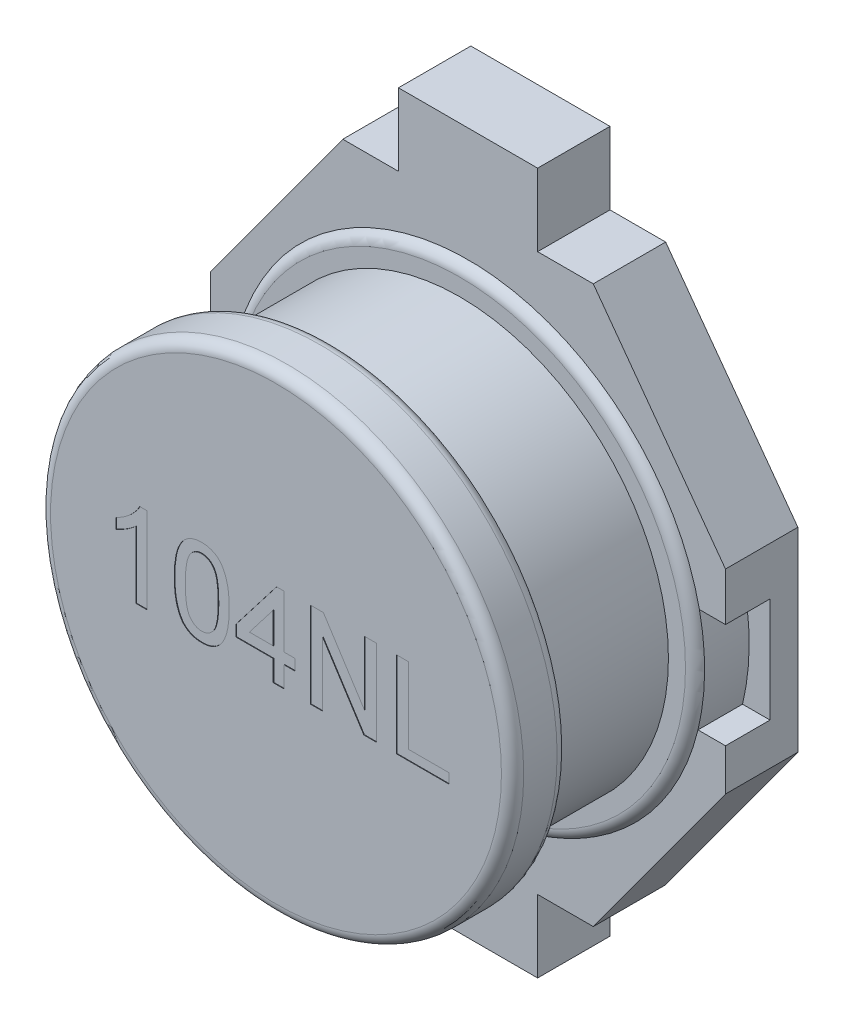
from build123d import *

# Parameters (mm, degrees)
EXTRUSION1_DEPTH        = 1.3
ESQUISSE2_R             = 4.25
EXTRUSION2_DEPTH        = 1.45
ESQUISSE3_R             = 3.75
EXTRUSION3_DEPTH        = 2.3
ESQUISSE4_R             = 4.25
EXTRUSION4_DEPTH        = 1
CONG_1_R                = 0.2
CONG_2_R                = 0.2
ENL_V_START             = -0.8
ENL_V_MAT_EXTRU_1_DEPTH = 0.8
ENL_V_MAT_EXTRU_3_DEPTH = 0.8
ESQUISSE8_W             = 2.5
ESQUISSE8_H             = 1.3
EXTRUSION5_DEPTH        = 1.3
ESQUISSE9_W             = 2.5
ESQUISSE9_H             = 1.3
EXTRUSION6_DEPTH        = 1.3
ENL_V_MAT_EXTRU_4_DEPTH = 0.01


with BuildPart() as part:
    # Esquisse1 → Extrusion1 (new body)
    with BuildSketch(Plane.XY):
        Polygon((-2.25, 5), (2.25, 5), (4.625, 1.75), (4.625, -1.75), (2.25, -5), (-2.25, -5), (-4.625, -1.75), (-4.625, 1.75), align=None)
    extrude(amount=EXTRUSION1_DEPTH)

    # Esquisse2 → Extrusion2 (add)
    with BuildSketch(Plane.XY):
        Circle(ESQUISSE2_R)
    extrude(amount=EXTRUSION2_DEPTH)

    # Esquisse3 → Extrusion3 (add)
    with BuildSketch(Plane.XY.offset(1.45)):
        Circle(ESQUISSE3_R)
    extrude(amount=EXTRUSION3_DEPTH)

    # Esquisse4 → Extrusion4 (add)
    with BuildSketch(Plane.XY.offset(3.75)):
        Circle(ESQUISSE4_R)
    extrude(amount=EXTRUSION4_DEPTH)

    # Congé1
    cong_1_edges = [part.edges().sort_by_distance(p)[0] for p in [
        (-4.25, 0, 3.75),
        (-4.25, 0, 4.75),
    ]]
    fillet(cong_1_edges, radius=CONG_1_R)

    # Congé2
    # the kernel refuses this fillet: 0.2 mm, written as the material it takes off along each edge
    with BuildSketch(Plane(origin=(0, 0, 1.45), x_dir=(1, 0, 0), z_dir=(0, -1, 0))) as cong_2_piece_1:
        with BuildLine():
            CenterArc((4.056350833, -0.2), CONG_2_R, 14.477512185, 75.522487815)
            Line((4.25, -0.15), (4.253872983, -0.149))
            ThreePointArc((4.253872983, -0.149), (4.254, -0.075), (4.254, 0))
            Line((4.254, 0), (4.25, 0.004))
            Line((4.25, 0.004), (4.056350833, 0.004))
            Line((4.056350833, 0.004), (4.056350833, 0))
        make_face()
    revolve(axis=Axis((0, 0, 1.45), (0, 0, 1)), mode=Mode.SUBTRACT)

    # Esquisse5 → Enlèv. mat.-Extru.1 (cut)
    with BuildSketch(Plane.XY.offset(1.3).offset(ENL_V_START)):
        with BuildLine():
            Line((-4.156639782, 0.885915188), (-4.625, 0.885915188))
            Line((-4.625, 0.885915188), (-4.625, -0.999494058))
            Line((-4.625, -0.999494058), (-4.130800362, -0.999494058))
            ThreePointArc((-4.130800362, -0.999494058), (-4.249600927, -0.058240526), (-4.156639782, 0.885915188))
        make_face()
    extrude(amount=ENL_V_MAT_EXTRU_1_DEPTH, mode=Mode.SUBTRACT)

    # Esquisse6 → Enlèv. mat.-Extru.3 (cut)
    with BuildSketch(Plane.XY.offset(1.3).offset(ENL_V_START)):
        with BuildLine():
            Line((4.625, 0.885915188), (4.156639782, 0.885915188))
            ThreePointArc((4.156639782, 0.885915188), (4.249600927, -0.058240526), (4.130800362, -0.999494058))
            Line((4.130800362, -0.999494058), (4.625, -0.999494058))
            Line((4.625, -0.999494058), (4.625, 0.885915188))
        make_face()
    extrude(amount=ENL_V_MAT_EXTRU_3_DEPTH, mode=Mode.SUBTRACT)

    # Esquisse8 → Extrusion5 (add)
    with BuildSketch(Plane(origin=(0, 5, 0), x_dir=(1, 0, 0), z_dir=(0, 1, 0))):
        with Locations((0, -0.65)):
            Rectangle(ESQUISSE8_W, ESQUISSE8_H)
    extrude(amount=EXTRUSION5_DEPTH)

    # Esquisse9 → Extrusion6 (add)
    with BuildSketch(Plane.XZ.offset(5)):
        with Locations((0, 0.65)):
            Rectangle(ESQUISSE9_W, ESQUISSE9_H)
    extrude(amount=EXTRUSION6_DEPTH)

    # Esquisse10 → Enlèv. mat.-Extru.4 (cut)
    # profile 1 of 5: a face of its own
    with BuildSketch(Plane.XY.offset(4.75)):
        with BuildLine():
            Line((-2.3217085, -0.630194645), (-2.519271476, -0.630194645))
            Line((-2.519271476, -0.630194645), (-2.519271476, 0.570617817))
            add(Edge.make_bspline(
                [(-2.519271476, 0.570617817), (-2.530647169, 0.55964736), (-2.554290302, 0.536846468), (-2.59425652, 0.504577512), (-2.638863927, 0.471871556), (-2.687533267, 0.440421124), (-2.737143426, 0.410813934), (-2.785085257, 0.384186818), (-2.830558352, 0.361653817), (-2.860511725, 0.349332684), (-2.874884832, 0.343420395)],
                knots=[0, 0, 0, 0, 0.893362401, 1.856755847, 2.901947673, 4.020460078, 5.132200827, 6.168787962, 7.121294059, 8, 8, 8, 8], degree=3))
            Line((-2.874884832, 0.343420395), (-2.874884832, 0.525548764))
            add(Edge.make_bspline(
                [(-2.874884832, 0.525548764), (-2.850197535, 0.538262771), (-2.801540335, 0.563321327), (-2.732798232, 0.606600897), (-2.668620085, 0.653517733), (-2.610068295, 0.704061447), (-2.557580346, 0.755726196), (-2.513347989, 0.807857957), (-2.476337168, 0.858545805), (-2.457768138, 0.893894958), (-2.448889666, 0.910796566)],
                knots=[0, 0, 0, 0, 1.141258006, 2.249351951, 3.335817539, 4.406819942, 5.426913362, 6.360259544, 7.215985427, 8, 8, 8, 8], degree=3))
            Line((-2.448889666, 0.910796566), (-2.3217085, 0.910796566))
            Line((-2.3217085, 0.910796566), (-2.3217085, -0.630194645))
        make_face()
    # profile 2 of 5: a face of its own
    with BuildSketch(Plane.XY.offset(4.75)):
        with BuildLine():
            add(Edge.make_bspline(
                [(-1.827801061, 0.129805428), (-1.827602016, 0.151827607), (-1.827212171, 0.194959781), (-1.82479409, 0.258069901), (-1.820572317, 0.318002969), (-1.814270372, 0.374706936), (-1.806807688, 0.428309793), (-1.797106152, 0.478735044), (-1.786190514, 0.526095826), (-1.773093707, 0.570342774), (-1.758704603, 0.611856329), (-1.742379706, 0.650569896), (-1.724011983, 0.686442429), (-1.704504092, 0.719845946), (-1.682829099, 0.750260884), (-1.660295262, 0.778540812), (-1.635264957, 0.803648595), (-1.608778997, 0.826230257), (-1.580447371, 0.846157258), (-1.55041998, 0.863351856), (-1.518812362, 0.878533446), (-1.48502211, 0.889962144), (-1.449750704, 0.899278955), (-1.412726642, 0.906132514), (-1.373909125, 0.910172918), (-1.347382808, 0.910586335), (-1.333893621, 0.910796566)],
                knots=[0, 0, 0, 0, 1.514747001, 2.966751498, 4.343369068, 5.64627492, 6.890416844, 8.064737671, 9.177176366, 10.232018008, 11.237056675, 12.19799043, 13.119080079, 14.007588942, 14.855863561, 15.685992447, 16.491747269, 17.290132607, 18.077525251, 18.870243746, 19.668095604, 20.485086593, 21.319398728, 22.175900658, 23.072407314, 24, 24, 24, 24], degree=3))
            add(Edge.make_bspline(
                [(-1.333893621, 0.910796566), (-1.314103229, 0.910214743), (-1.275224211, 0.909071727), (-1.218460643, 0.899749499), (-1.164964639, 0.883802391), (-1.114770954, 0.862289055), (-1.068737642, 0.834962977), (-1.027627955, 0.801743966), (-0.991885326, 0.762980815), (-0.96189983, 0.718214193), (-0.935689515, 0.668679063), (-0.912404845, 0.614153093), (-0.891356181, 0.554697386), (-0.87641959, 0.501476227), (-0.865765332, 0.455533835), (-0.85871306, 0.417641849), (-0.85285826, 0.376756183), (-0.848372693, 0.33297575), (-0.84469239, 0.286349655), (-0.841850261, 0.236848865), (-0.84040759, 0.184349664), (-0.840129284, 0.148327683), (-0.839986182, 0.129805428)],
                knots=[0, 0, 0, 0, 1.134486744, 2.228744715, 3.287356444, 4.328707449, 5.352829806, 6.347195599, 7.349461267, 8.364207941, 9.428085653, 10.559314403, 11.761222316, 13.04268526, 13.726896727, 14.465273606, 15.252205015, 16.094778733, 16.988606776, 17.934225168, 18.937792761, 20, 20, 20, 20], degree=3))
            add(Edge.make_bspline(
                [(-0.839986182, 0.129805428), (-0.840188955, 0.10788669), (-0.840585112, 0.065064122), (-0.842938399, 0.002460039), (-0.847414564, -0.057020863), (-0.852922566, -0.113514837), (-0.86125502, -0.166871071), (-0.870233691, -0.217316262), (-0.881338088, -0.264621343), (-0.894294313, -0.308807048), (-0.908885964, -0.350107015), (-0.924887968, -0.388833365), (-0.942611723, -0.424959637), (-0.962584756, -0.458133472), (-0.98389321, -0.488795199), (-1.006693147, -0.517059836), (-1.031467952, -0.542520573), (-1.058192591, -0.565034503), (-1.086325294, -0.58531488), (-1.116425687, -0.602679241), (-1.148362026, -0.617065312), (-1.181920931, -0.629364689), (-1.217442906, -0.63837695), (-1.254647829, -0.645275695), (-1.293672781, -0.649338176), (-1.320301699, -0.649743869), (-1.333893621, -0.649950942)],
                knots=[0, 0, 0, 0, 1.508974709, 2.94807912, 4.311757619, 5.615040294, 6.854280449, 8.028314546, 9.141715822, 10.197470207, 11.196696834, 12.155719058, 13.080757287, 13.963948316, 14.818758719, 15.649605906, 16.461113142, 17.260189315, 18.052359509, 18.845763934, 19.647754795, 20.461145776, 21.303032214, 22.167241874, 23.064524267, 24, 24, 24, 24], degree=3))
            add(Edge.make_bspline(
                [(-1.333893621, -0.649950942), (-1.351714208, -0.649442609), (-1.386459446, -0.648451499), (-1.437202306, -0.641717519), (-1.484827185, -0.629865397), (-1.529735775, -0.613970031), (-1.571423289, -0.592709063), (-1.610088768, -0.566840944), (-1.646509169, -0.536967522), (-1.667474965, -0.513398079), (-1.678085368, -0.501470018)],
                knots=[0, 0, 0, 0, 1.10322584, 2.150986741, 3.161425019, 4.136713905, 5.093944212, 6.049774532, 7.013026876, 8, 8, 8, 8], degree=3))
            add(Edge.make_bspline(
                [(-1.678085368, -0.501470018), (-1.690298186, -0.48385285), (-1.715481539, -0.447525494), (-1.74495647, -0.385583982), (-1.77124863, -0.317395074), (-1.791883155, -0.241620912), (-1.808045132, -0.158864573), (-1.819718115, -0.068963671), (-1.826323874, 0.028042955), (-1.827297549, 0.095118861), (-1.827801061, 0.129805428)],
                knots=[0, 0, 0, 0, 0.779365345, 1.607084704, 2.489375761, 3.438383567, 4.461919411, 5.557722155, 6.737039282, 8, 8, 8, 8], degree=3))
        make_face()
        with BuildLine():
            add(Edge.make_bspline(
                [(-1.630238085, 0.130422812), (-1.63004192, 0.100783946), (-1.629666419, 0.044048601), (-1.625743335, -0.037007628), (-1.618989908, -0.110131411), (-1.610061437, -0.175221503), (-1.59827224, -0.232365952), (-1.583469509, -0.281419135), (-1.56678331, -0.322969802), (-1.546134456, -0.356502965), (-1.52352624, -0.383837384), (-1.500184803, -0.407345869), (-1.475561001, -0.427327542), (-1.4498155, -0.443988183), (-1.422548842, -0.456602526), (-1.394059182, -0.46574543), (-1.364340322, -0.47100703), (-1.344100428, -0.471763023), (-1.333893621, -0.472144264)],
                knots=[0, 0, 0, 0, 1.89448813, 3.626469325, 5.185477471, 6.587276848, 7.82441448, 8.910550357, 9.859733512, 10.6775885, 11.416198291, 12.123144072, 12.791880183, 13.439617036, 14.078171869, 14.70637855, 15.347637704, 16, 16, 16, 16], degree=3))
            add(Edge.make_bspline(
                [(-1.333893621, -0.472144264), (-1.32368937, -0.471754693), (-1.303454544, -0.470982181), (-1.273667016, -0.465836604), (-1.245288203, -0.45622303), (-1.218062199, -0.443653241), (-1.192129573, -0.427372347), (-1.167626705, -0.407315198), (-1.14416231, -0.383820671), (-1.12165565, -0.356168539), (-1.101164111, -0.322480341), (-1.0841649, -0.280963521), (-1.069592861, -0.231824432), (-1.057738974, -0.174709098), (-1.048773672, -0.109721918), (-1.042061077, -0.036800948), (-1.03811174, 0.044150989), (-1.037742435, 0.100783812), (-1.037549158, 0.130422812)],
                knots=[0, 0, 0, 0, 0.652509534, 1.29391342, 1.924290653, 2.562989607, 3.207355802, 3.876242846, 4.583348185, 5.32723334, 6.150888545, 7.094226006, 8.186903555, 9.424320409, 10.81992305, 12.379283064, 14.105084285, 16, 16, 16, 16], degree=3))
            add(Edge.make_bspline(
                [(-1.037549158, 0.130422812), (-1.037736246, 0.15944512), (-1.038094701, 0.215050764), (-1.042145898, 0.294545443), (-1.048494487, 0.366441873), (-1.057178348, 0.430806336), (-1.068719198, 0.487568955), (-1.082716674, 0.536850572), (-1.099396761, 0.578546083), (-1.119229324, 0.613074322), (-1.141306935, 0.641396846), (-1.164369093, 0.665912454), (-1.188992353, 0.68676218), (-1.215612967, 0.703488138), (-1.243372901, 0.716982018), (-1.272910009, 0.726268851), (-1.303933963, 0.73197439), (-1.3252253, 0.732647521), (-1.336054466, 0.732989888)],
                knots=[0, 0, 0, 0, 1.850066095, 3.544656626, 5.0727657, 6.45041401, 7.682899467, 8.762389858, 9.712573485, 10.538438529, 11.291566246, 11.996865408, 12.681389046, 13.341983376, 13.996294293, 14.643563182, 15.31009126, 16, 16, 16, 16], degree=3))
            add(Edge.make_bspline(
                [(-1.336054466, 0.732989888), (-1.346260632, 0.732722017), (-1.366385882, 0.732193808), (-1.395851885, 0.727152064), (-1.423776469, 0.718721145), (-1.450479561, 0.707300646), (-1.475294532, 0.691930911), (-1.499205482, 0.673985651), (-1.521092514, 0.652121354), (-1.534281448, 0.635775948), (-1.541026054, 0.627417173)],
                knots=[0, 0, 0, 0, 1.021318143, 2.013908504, 2.982026795, 3.937174072, 4.91255697, 5.897578595, 6.924855925, 8, 8, 8, 8], degree=3))
            add(Edge.make_bspline(
                [(-1.541026054, 0.627417173), (-1.548368872, 0.615140722), (-1.563875358, 0.589215442), (-1.581226214, 0.544156237), (-1.596553275, 0.492662143), (-1.609172527, 0.433940886), (-1.618301671, 0.368093195), (-1.625508777, 0.295195541), (-1.629252601, 0.21514615), (-1.629900527, 0.159443106), (-1.630238085, 0.130422812)],
                knots=[0, 0, 0, 0, 0.671104906, 1.417232262, 2.260109084, 3.195198885, 4.23592645, 5.382417421, 6.636286093, 8, 8, 8, 8], degree=3))
        make_face(mode=Mode.SUBTRACT)
    # profile 3 of 5: a face of its own
    with BuildSketch(Plane.XY.offset(4.75)):
        Polygon((-0.049734279, -0.630194645), (-0.049734279, -0.254824991), (-0.721448396, -0.254824991), (-0.721448396, -0.057262015), (0.009534614, 0.891040269), (0.147828697, 0.891040269), (0.147828697, -0.057262015), (0.345391673, -0.057262015), (0.345391673, -0.254824991), (0.147828697, -0.254824991), (0.147828697, -0.630194645), align=None)
        Polygon((-0.049734279, -0.057262015), (-0.049734279, 0.49776647), (-0.477581598, -0.057262015), align=None, mode=Mode.SUBTRACT)
    # profile 4 of 5: a face of its own
    with BuildSketch(Plane.XY.offset(4.75)):
        Polygon((0.621979839, -0.630194645), (0.621979839, 0.910796566), (0.851646798, 0.910796566), (1.59003842, -0.239081691), (1.59003842, 0.910796566), (1.807357693, 0.910796566), (1.807357693, -0.630194645), (1.577690734, -0.630194645), (0.839299112, 0.519683613), (0.839299112, -0.630194645), align=None)
    # profile 5 of 5: a face of its own
    with BuildSketch(Plane.XY.offset(4.75)):
        Polygon((2.16297105, -0.630194645), (2.16297105, 0.910796566), (2.380290323, 0.910796566), (2.380290323, -0.452387966), (3.111273333, -0.452387966), (3.111273333, -0.630194645), align=None)
    extrude(amount=-ENL_V_MAT_EXTRU_4_DEPTH, mode=Mode.SUBTRACT)


solid = part.part
